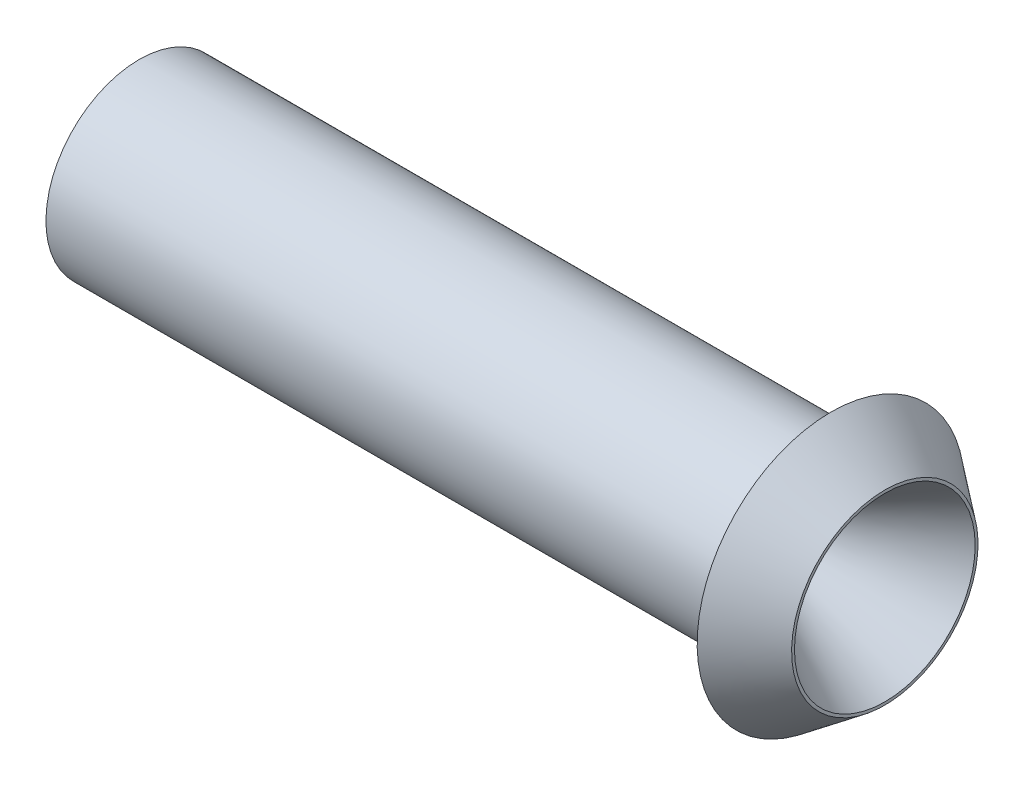
from build123d import *


with BuildPart() as part:
    # Sketch1 → Revolve1 (revolve)
    with BuildSketch(Plane.XY):
        Polygon((0, 8.255), (0, 8.001), (54.785423113, 2.24282), (56.055423113, 2.24282), (66.028883432, 8.001), (66.028883432, 8.255), (61.259351639, 11.8491), (61.259351639, 8.255), align=None)
    revolve(axis=Axis((66.028883432, 0, 0), (-1, 0, 0)))


solid = part.part
